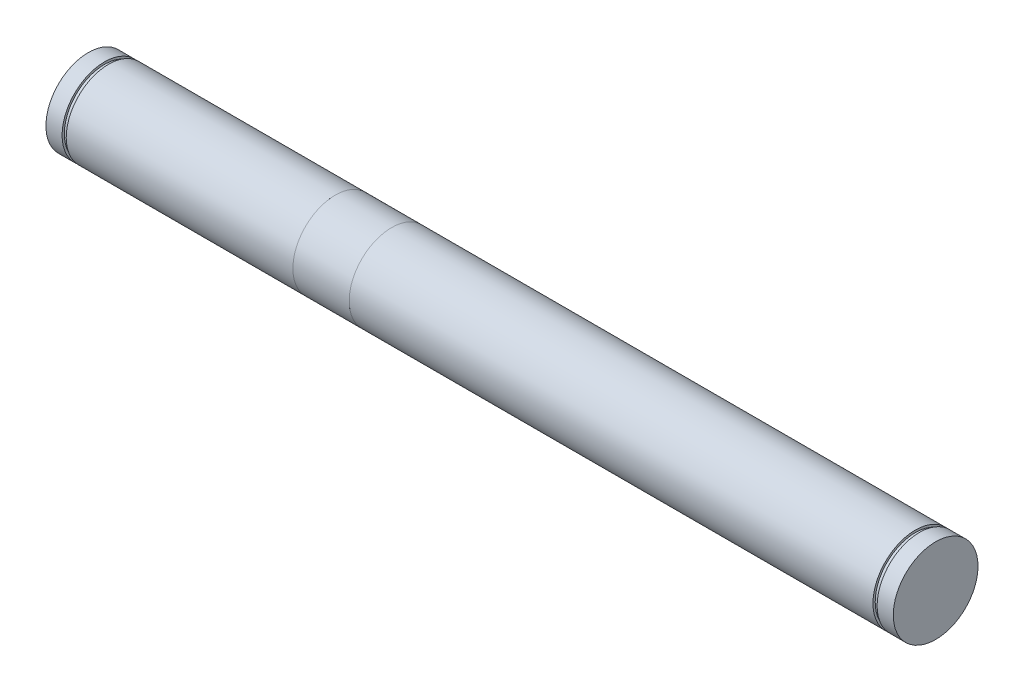
from build123d import *

# Parameters (mm, degrees)
SKIZZE19_W = 1.85
SKIZZE19_H = 1
SKIZZE20_W = 1.85
SKIZZE20_H = 1
SKETCH1_W  = 14.101371306
SKETCH1_H  = 11.293421516


with BuildPart() as part:
    # Skizze1 → Rotation1 (revolve)
    with BuildSketch(Plane.XY):
        Polygon((190, 19), (190, 0), (-190, 0), (-190, 19), (-89, 19), (-89, 27), (-84, 27), (-84, 19.001), (-54, 19.001), (-54, 19), align=None)
    revolve(axis=Axis((190, 0, 0), (-1, 0, 0)))

    # Skizze19 → Schnitt-Rotation1 (revolve, cut)
    with BuildSketch(Plane.XY):
        with Locations((181.825, 18.5)):
            Rectangle(SKIZZE19_W, SKIZZE19_H)
    revolve(axis=Axis((-88.99, 0, 0), (1, 0, 0)), mode=Mode.SUBTRACT)

    # Skizze20 → Schnitt-Rotation2 (revolve, cut)
    with BuildSketch(Plane.XY):
        with Locations((-181.825, 18.5)):
            Rectangle(SKIZZE20_W, SKIZZE20_H)
    revolve(axis=Axis((-88.99, 0, 0), (1, 0, 0)), mode=Mode.SUBTRACT)

    # Sketch1 → Cut-Revolve1 (revolve, cut)
    with BuildSketch(Plane.XY):
        with Locations((-86.280304753, 24.646710758)):
            Rectangle(SKETCH1_W, SKETCH1_H)
    revolve(axis=Axis((-191.164691911, 0, 0), (1, 0, 0)), mode=Mode.SUBTRACT)


solid = part.part
